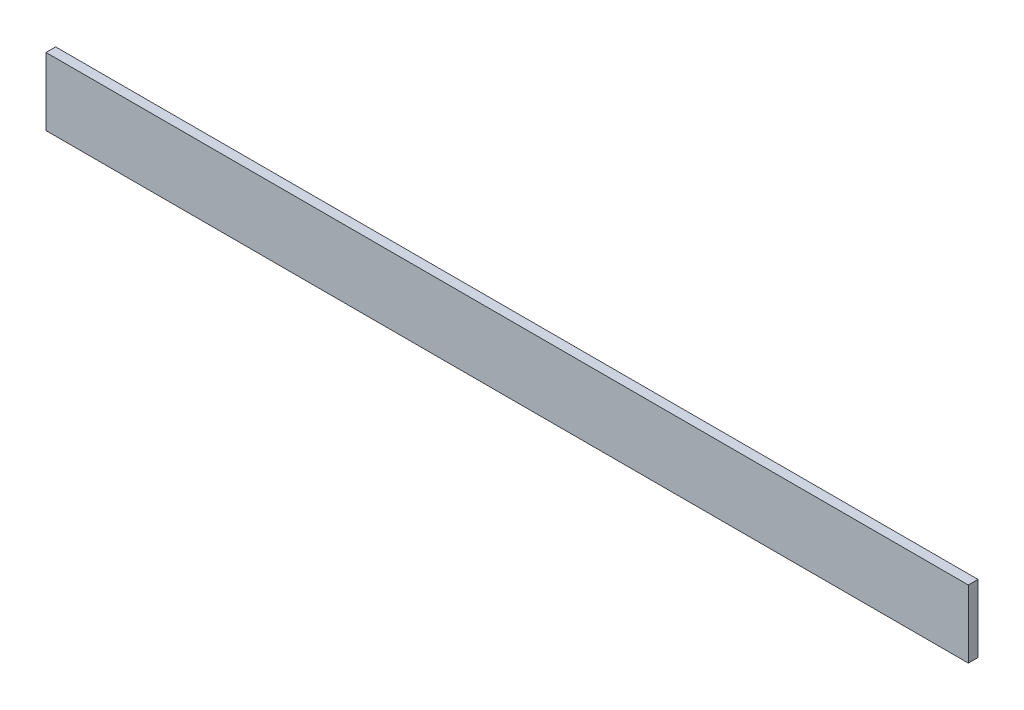
from build123d import *

# Parameters (mm, degrees)
SKETCH_2_W             = 954
SKETCH_2_H             = 70
SM_BASE_FLANGE_1_DEPTH = 10


# Sheet-metal steps are written as plain solids
with BuildPart() as part:
    # Sketch 2 → 基体-法兰1 (new body)
    with BuildSketch(Plane.XY):
        Rectangle(SKETCH_2_W, SKETCH_2_H)
    extrude(amount=-SM_BASE_FLANGE_1_DEPTH)


solid = part.part
